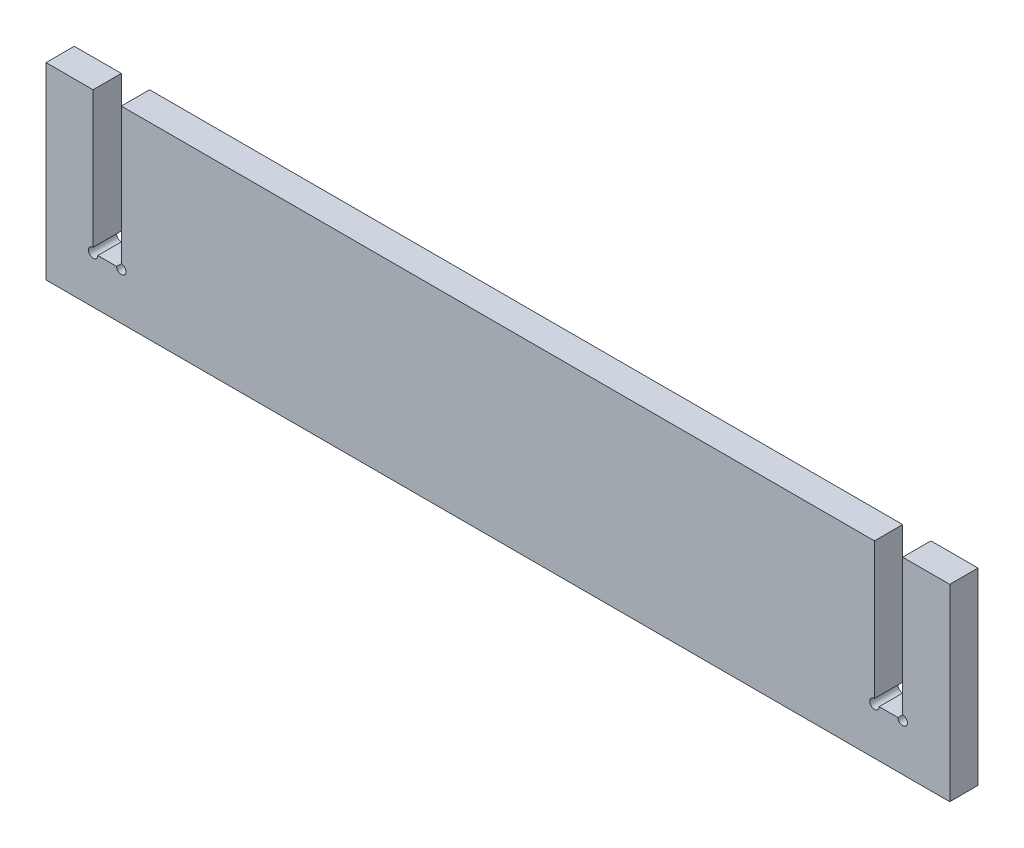
from build123d import *

# Parameters (mm, degrees)
BOSS_EXTRUDE1_DEPTH = 3
SKETCH2_R           = 0.5
CUT_EXTRUDE1_DEPTH  = 50.122296363


with BuildPart() as part:
    # Sketch1 → Boss-Extrude1 (new body)
    with BuildSketch(Plane.XY):
        Polygon((-43, 10), (-43, -5), (-40, -5), (-40, 10), (40, 10), (40, -5), (43, -5), (43, 10), (48, 10), (48, -10), (-48, -10), (-48, 10), align=None)
    extrude(amount=BOSS_EXTRUDE1_DEPTH)

    # Sketch2 → Cut-Extrude1 (cut, through all)
    with BuildSketch(Plane.XY.offset(3)):
        with Locations((-43, -5)):
            Circle(SKETCH2_R)
        with Locations((-40, -5)):
            Circle(SKETCH2_R)
        with Locations((40, -5)):
            Circle(SKETCH2_R)
        with Locations((43, -5)):
            Circle(SKETCH2_R)
    extrude(amount=-CUT_EXTRUDE1_DEPTH, mode=Mode.SUBTRACT)


solid = part.part
